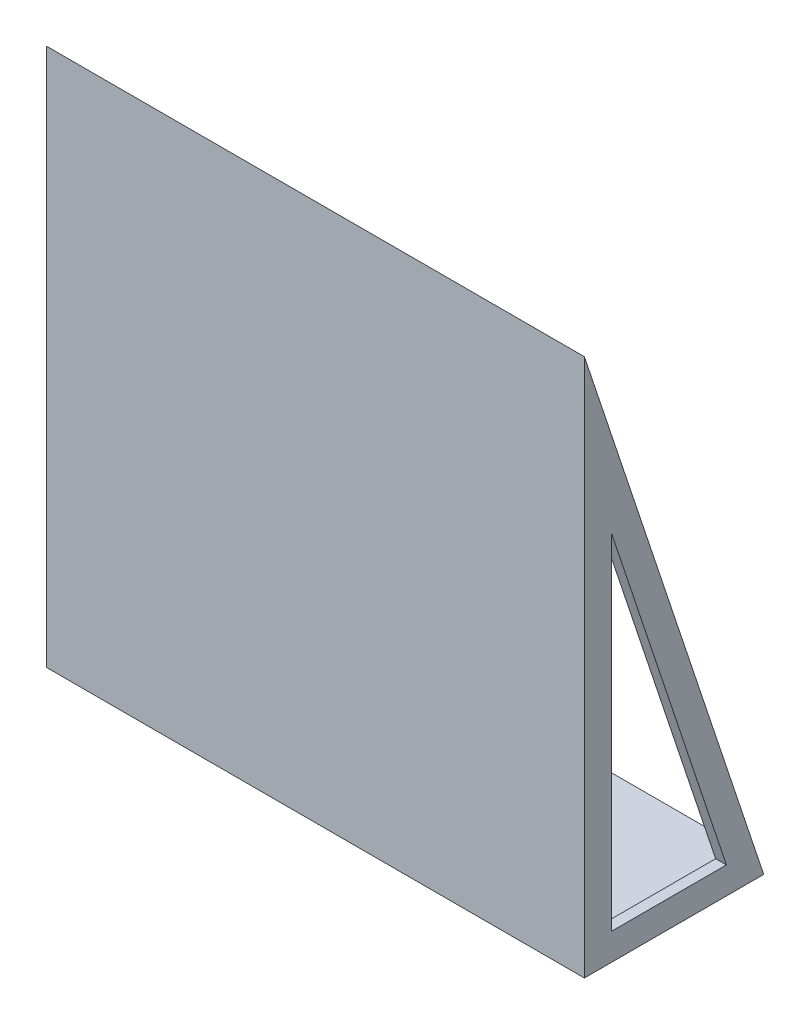
from build123d import *

# Parameters (mm, degrees)
SKETCH1_W           = 300
SKETCH1_H           = 300
BOSS_EXTRUDE1_DEPTH = 100
SKETCH4_W           = 288
SKETCH4_H           = 94
CUT_EXTRUDE1_DEPTH  = 290
CUT_EXTRUDE2_DEPTH  = 309.1
CUT_EXTRUDE3_DEPTH  = 309.1


with BuildPart() as part:
    # Sketch1 → Boss-Extrude1 (new body)
    with BuildSketch(Plane.XY):
        Rectangle(SKETCH1_W, SKETCH1_H)
    extrude(amount=-BOSS_EXTRUDE1_DEPTH)

    # Sketch4 → Cut-Extrude1 (cut)
    with BuildSketch(Plane(origin=(0, 150, 0), x_dir=(1, 0, 0), z_dir=(0, 1, 0))):
        with Locations((0, 53)):
            Rectangle(SKETCH4_W, SKETCH4_H)
    extrude(amount=-CUT_EXTRUDE1_DEPTH, mode=Mode.SUBTRACT)

    # Sketch3 → Cut-Extrude2 (cut)
    with BuildSketch(Plane.ZY.offset(150)):
        Polygon((-100, 150), (-100, -150), (0, 150), align=None)
    extrude(amount=-CUT_EXTRUDE2_DEPTH, mode=Mode.SUBTRACT)

    # Sketch5 → Cut-Extrude3 (cut)
    with BuildSketch(Plane.ZY.offset(150)):
        Polygon((-15, -135), (-15, 57.565835097), (-79.188611699, -135), align=None)
    extrude(amount=-CUT_EXTRUDE3_DEPTH, mode=Mode.SUBTRACT)


solid = part.part
